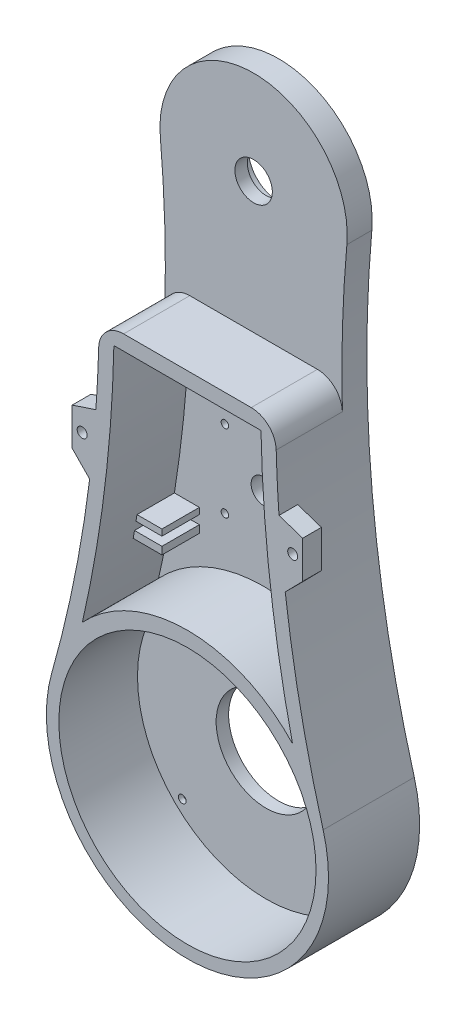
from build123d import *

# Parameters (mm, degrees)
SKETCH1_R               = 20
SKETCH1_R_2             = 7.5
BOSS_EXTRUDE1_DEPTH     = 36.5
SKETCH4_R               = 51.5
CUT_EXTRUDE3_DEPTH      = 31.5
CUT_EXTRUDE4_DEPTH      = 247.841548367
CUT_EXTRUDE4_DEPTH_BACK = 247.841548367
SKETCH5_W               = 26.5
SKETCH5_H               = 90
SHELL1_START            = 6
SHELL1_DEPTH            = 30.5
BOSS_EXTRUDE2_START     = -7.5
SKETCH7_R               = 2
BOSS_EXTRUDE2_DEPTH     = 7.5
BOSS_EXTRUDE3_DEPTH     = 15
CUT_EXTRUDE5_DEPTH      = 247.025913269
CUT_EXTRUDE5_DEPTH_BACK = 6
SKETCH9_R               = 5
SKETCH9_R_2             = 1.5
CUT_EXTRUDE6_DEPTH      = 6
FILLET1_R               = 10
SKETCH11_R              = 1.55
CUT_EXTRUDE7_DEPTH      = 247.841548367
SKETCH12_R              = 3.55
CUT_EXTRUDE8_DEPTH      = 3
SKETCH13_R              = 12.1
CUT_EXTRUDE9_DEPTH      = 5


# Read off the part's stored shape, not the designer's step: Shell1
with BuildPart() as part:
    # Sketch1 → Boss-Extrude1 (new body)
    with BuildSketch(Plane.XY):
        with BuildLine():
            ThreePointArc((-54.352625843, 15.42861186), (0, -56.5), (54.352625843, 15.42861186))
            ThreePointArc((54.352625843, 15.42861186), (37.535595393, 105.258460348), (37.34995219, 196.64872093))
            ThreePointArc((37.34995219, 196.64872093), (0, 237.5), (-37.34995219, 196.64872093))
            ThreePointArc((-37.34995219, 196.64872093), (-37.535595393, 105.258460348), (-54.352625843, 15.42861186))
        make_face()
        Circle(SKETCH1_R, mode=Mode.SUBTRACT)
        with Locations((0, 200)):
            Circle(SKETCH1_R_2, mode=Mode.SUBTRACT)
    extrude(amount=BOSS_EXTRUDE1_DEPTH)

    # Sketch4 → Cut-Extrude3 (cut)
    with BuildSketch(Plane.XY.offset(36.5)):
        Circle(SKETCH4_R)
    extrude(amount=-CUT_EXTRUDE3_DEPTH, mode=Mode.SUBTRACT)

    # Sketch5 → Cut-Extrude4 (cut, two sides: drawn at the far end of the back side and taken through both)
    with BuildSketch(Plane(origin=(0, 0, 0), x_dir=(0, 0, -1), z_dir=(1, 0, 0)).offset(-CUT_EXTRUDE4_DEPTH_BACK)):
        with Locations((-23.25, 192.5)):
            Rectangle(SKETCH5_W, SKETCH5_H)
    extrude(amount=CUT_EXTRUDE4_DEPTH + CUT_EXTRUDE4_DEPTH_BACK, mode=Mode.SUBTRACT)

    # Shell1 outline → Shell1 (cut)
    with BuildSketch(Plane.XY.offset(SHELL1_START)):
        with BuildLine():
            ThreePointArc((-42.077009937, 39.188968279), (0, 57.5), (42.077009937, 39.188968279))
            ThreePointArc((42.077009937, 39.188968279), (33.155030313, 90.022278833), (29.457543912, 141.5))
            Line((29.457543912, 141.5), (-29.457543912, 141.5))
            ThreePointArc((-29.457543912, 141.5), (-33.155030313, 90.022278833), (-42.077009937, 39.188968279))
        make_face()
    extrude(amount=SHELL1_DEPTH, mode=Mode.SUBTRACT)

    # Sketch7 → Boss-Extrude2 (add)
    # profile 1 of 2: a face of its own
    with BuildSketch(Plane.XY.offset(36.5).offset(BOSS_EXTRUDE2_START)):
        with BuildLine():
            Line((-39.159181835, 90.358571571), (-46.159181835, 97.5))
            Line((-46.159181835, 97.5), (-46.159181835, 112.5))
            Line((-46.159181835, 112.5), (-36.669554937, 115.653883533))
            ThreePointArc((-36.669554937, 115.653883533), (-37.753606302, 102.990404952), (-39.159181835, 90.358571571))
        make_face()
        with Locations((-42.159181835, 105)):
            Circle(SKETCH7_R, mode=Mode.SUBTRACT)
    # profile 2 of 2: a face of its own
    with BuildSketch(Plane.XY.offset(36.5).offset(BOSS_EXTRUDE2_START)):
        with BuildLine():
            Line((46.159181835, 97.5), (46.159181835, 112.5))
            Line((46.159181835, 112.5), (36.669554937, 115.653883533))
            ThreePointArc((36.669554937, 115.653883533), (37.753606302, 102.990404952), (39.159181835, 90.358571571))
            Line((39.159181835, 90.358571571), (46.159181835, 97.5))
        make_face()
        with Locations(Location((42.159181835, 105, 0), (0, 0, 180))):
            Circle(SKETCH7_R, mode=Mode.SUBTRACT)
    extrude(amount=BOSS_EXTRUDE2_DEPTH)

    # Sketch8 → Boss-Extrude3 (add)
    with BuildSketch(Plane.XY.offset(6)):
        with BuildLine():
            Line((-35.707844492, 72), (-25.707844492, 72))
            Line((-25.707844492, 72), (-25.707844492, 69.5))
            Line((-25.707844492, 69.5), (-36.114376268, 69.5))
            ThreePointArc((-36.114376268, 69.5), (-35.909546125, 70.749745632), (-35.707844492, 72))
        make_face()
        with BuildLine():
            Line((-36.705134195, 66), (-25.707844492, 66))
            Line((-25.707844492, 66), (-25.707844492, 63))
            Line((-25.707844492, 63), (-37.231629056, 63))
            ThreePointArc((-37.231629056, 63), (-36.966124321, 64.499603847), (-36.705134195, 66))
        make_face()
        with BuildLine():
            Line((25.707844492, 63), (37.231629056, 63))
            ThreePointArc((37.231629056, 63), (36.966124321, 64.499603847), (36.705134195, 66))
            Line((36.705134195, 66), (25.707844492, 66))
            Line((25.707844492, 66), (25.707844492, 63))
        make_face()
        with BuildLine():
            Line((25.707844492, 69.5), (36.114376268, 69.5))
            ThreePointArc((36.114376268, 69.5), (35.909546125, 70.749745632), (35.707844492, 72))
            Line((35.707844492, 72), (25.707844492, 72))
            Line((25.707844492, 72), (25.707844492, 69.5))
        make_face()
    extrude(amount=BOSS_EXTRUDE3_DEPTH)

    # Sketch9 → Cut-Extrude5 (cut, two sides: drawn at the far end of the back side and taken through both)
    with BuildSketch(Plane.XY.offset(6).offset(-CUT_EXTRUDE5_DEPTH_BACK)):
        with Locations((0, 90.5)):
            Circle(SKETCH9_R)
        with Locations((-15.5, 106)):
            Circle(SKETCH9_R_2)
        with Locations((15.5, 106)):
            Circle(SKETCH9_R_2)
        with Locations((15.5, 75)):
            Circle(SKETCH9_R_2)
        with Locations((-15.5, 75)):
            Circle(SKETCH9_R_2)
    extrude(amount=CUT_EXTRUDE5_DEPTH + CUT_EXTRUDE5_DEPTH_BACK, mode=Mode.SUBTRACT)

    # Sketch10 → Cut-Extrude6 (cut)
    with BuildSketch(Plane.XY.offset(6)):
        with BuildLine():
            Line((-13.327049627, 124), (-1.672950373, 124))
            ThreePointArc((-1.672950373, 124), (-0.48999582, 123.51000418), (0, 122.327049627))
            Line((0, 122.327049627), (0, 122.172950373))
            ThreePointArc((0, 122.172950373), (-0.48999582, 120.98999582), (-1.672950373, 120.5))
            Line((-1.672950373, 120.5), (-13.327049627, 120.5))
            ThreePointArc((-13.327049627, 120.5), (-14.51000418, 120.98999582), (-15, 122.172950373))
            Line((-15, 122.172950373), (-15, 122.327049627))
            ThreePointArc((-15, 122.327049627), (-14.51000418, 123.51000418), (-13.327049627, 124))
        make_face()
    extrude(amount=-CUT_EXTRUDE6_DEPTH, mode=Mode.SUBTRACT)

    # Fillet1
    fillet1_edges = [part.edges().sort_by_distance(p)[0] for p in [
        (35.369251346, 147.5, 23.25),
        (-35.369251346, 147.5, 23.25),
    ]]
    fillet(fillet1_edges, radius=FILLET1_R)

    # Sketch11 → Cut-Extrude7 (cut, through all)
    with BuildSketch(Plane(origin=(0, 0, 0), x_dir=(-1, 0, 0), z_dir=(0, 0, -1))):
        with Locations((-33.587572106, 33.587572106)):
            Circle(SKETCH11_R)
        with Locations((33.587572106, 33.587572106)):
            Circle(SKETCH11_R)
        with Locations((33.587572106, -33.587572106)):
            Circle(SKETCH11_R)
        with Locations((-33.587572106, -33.587572106)):
            Circle(SKETCH11_R)
    extrude(amount=-CUT_EXTRUDE7_DEPTH, mode=Mode.SUBTRACT)

    # Sketch12 → Cut-Extrude8 (cut)
    with BuildSketch(Plane(origin=(0, 0, 0), x_dir=(-1, 0, 0), z_dir=(0, 0, -1))):
        with Locations((-33.587572106, -33.587572106)):
            Circle(SKETCH12_R)
        with Locations((33.587572106, -33.587572106)):
            Circle(SKETCH12_R)
        with Locations((33.587572106, 33.587572106)):
            Circle(SKETCH12_R)
        with Locations((-33.587572106, 33.587572106)):
            Circle(SKETCH12_R)
    extrude(amount=-CUT_EXTRUDE8_DEPTH, mode=Mode.SUBTRACT)

    # Sketch13 → Cut-Extrude9 (cut)
    with BuildSketch(Plane(origin=(0, 0, 0), x_dir=(-1, 0, 0), z_dir=(0, 0, -1))):
        with Locations((0, 200)):
            Circle(SKETCH13_R)
    extrude(amount=-CUT_EXTRUDE9_DEPTH, mode=Mode.SUBTRACT)


solid = part.part
